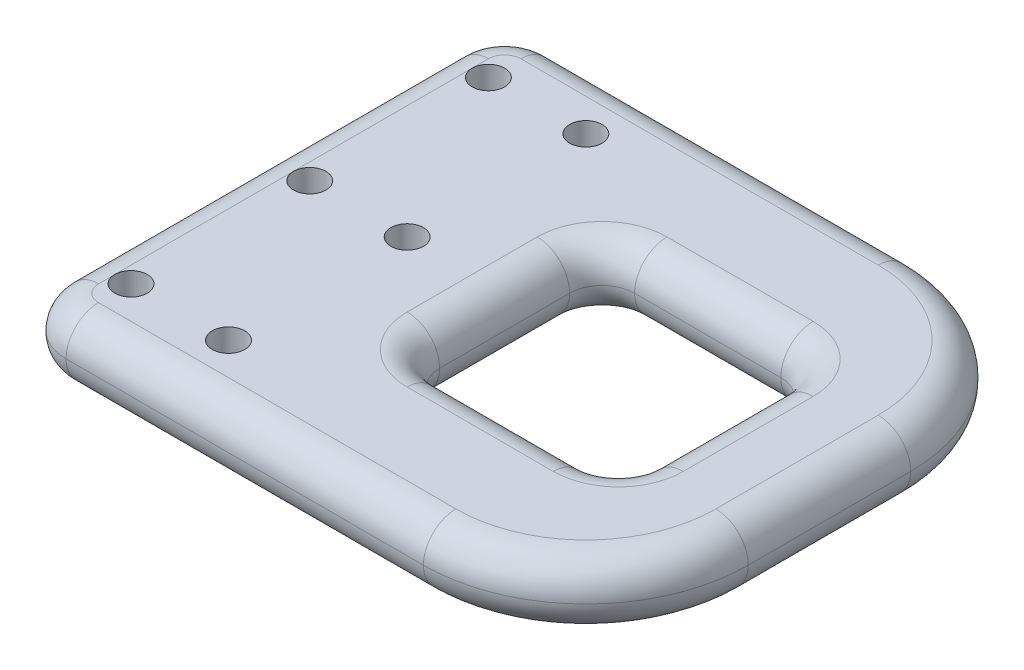
from build123d import *

# Parameters (mm, degrees)
SKETCH1_R           = 1
BOSS_EXTRUDE1_DEPTH = 2
FILLET1_R           = 2


with BuildPart() as part:
    # Sketch1 → Boss-Extrude1 (new, symmetric)
    with BuildSketch(Plane(origin=(0, 0, 0), x_dir=(1, 0, 0), z_dir=(0, 1, 0))):
        with BuildLine():
            Line((-14.5, 15), (7.5, 15))
            ThreePointArc((7.5, 15), (14.571067812, 12.071067812), (17.5, 5))
            Line((17.5, 5), (17.5, -5))
            ThreePointArc((17.5, -5), (14.571067812, -12.071067812), (7.5, -15))
            Line((7.5, -15), (-14.5, -15))
            ThreePointArc((-14.5, -15), (-16.621320344, -14.121320344), (-17.5, -12))
            Line((-17.5, -12), (-17.5, 12))
            ThreePointArc((-17.5, 12), (-16.621320344, 14.121320344), (-14.5, 15))
        make_face()
        with Locations(Location((-8.5, 11, 0), (0, 0, 270))):
            Circle(SKETCH1_R, mode=Mode.SUBTRACT)
        with Locations(Location((-14.5, 11, 0), (0, 0, 270))):
            Circle(SKETCH1_R, mode=Mode.SUBTRACT)
        with Locations(Location((-14.5, -11, 0), (0, 0, 270))):
            Circle(SKETCH1_R, mode=Mode.SUBTRACT)
        with Locations(Location((-8.5, -11, 0), (0, 0, 270))):
            Circle(SKETCH1_R, mode=Mode.SUBTRACT)
        with Locations(Location((-8.5, 0, 0), (0, 0, 270))):
            Circle(SKETCH1_R, mode=Mode.SUBTRACT)
        with Locations(Location((-14.5, 0, 0), (0, 0, 270))):
            Circle(SKETCH1_R, mode=Mode.SUBTRACT)
        with BuildLine():
            Line((-0.5, 6), (8.5, 6))
            ThreePointArc((8.5, 6), (9.914213562, 5.414213562), (10.5, 4))
            Line((10.5, 4), (10.5, -4))
            ThreePointArc((10.5, -4), (9.914213562, -5.414213562), (8.5, -6))
            Line((8.5, -6), (-0.5, -6))
            ThreePointArc((-0.5, -6), (-1.914213562, -5.414213562), (-2.5, -4))
            Line((-2.5, -4), (-2.5, 4))
            ThreePointArc((-2.5, 4), (-1.914213562, 5.414213562), (-0.5, 6))
        make_face(mode=Mode.SUBTRACT)
    extrude(amount=BOSS_EXTRUDE1_DEPTH, both=True)

    # Fillet1
    fillet1_edges = [part.edges().sort_by_distance(p)[0] for p in [
        (14.571067812, -2, 12.071067812),
        (-3.5, -2, 15),
        (-16.621320344, -2, 14.121320344),
        (-17.5, -2, 0),
        (-16.621320344, -2, -14.121320344),
        (-3.5, -2, -15),
        (14.571067812, -2, -12.071067812),
        (14.571067812, 2, 12.071067812),
        (-3.5, 2, 15),
        (-16.621320344, 2, 14.121320344),
        (-17.5, 2, 0),
        (-16.621320344, 2, -14.121320344),
        (-3.5, 2, -15),
        (14.571067812, 2, -12.071067812),
        (9.914213562, -2, 5.414213562),
        (4, -2, 6),
        (-1.914213562, -2, 5.414213562),
        (-2.5, -2, 0),
        (-1.914213562, -2, -5.414213562),
        (4, -2, -6),
        (9.914213562, -2, -5.414213562),
        (-1.914213562, 2, -5.414213562),
        (4, 2, -6),
        (9.914213562, 2, -5.414213562),
        (10.5, 2, 0),
        (9.914213562, 2, 5.414213562),
        (4, 2, 6),
        (-1.914213562, 2, 5.414213562),
        (17.5, -2, 0),
        (17.5, 2, 0),
        (10.5, -2, 0),
        (-2.5, 2, 0),
    ]]
    fillet(fillet1_edges, radius=FILLET1_R - 0.0001)  # a hair under: the kernel refuses the full size


solid = part.part
